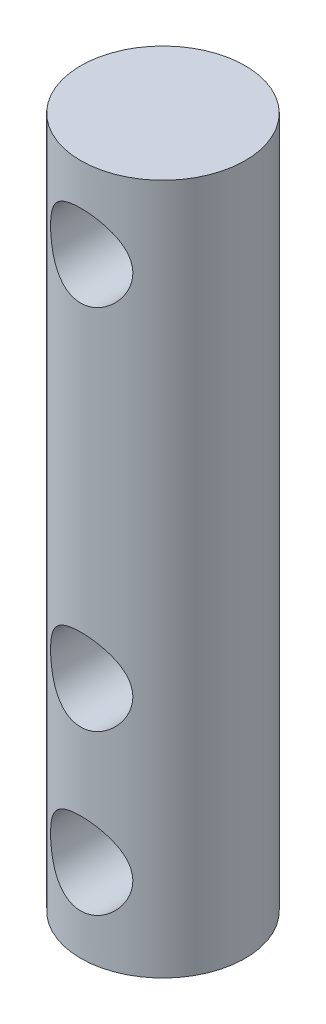
from build123d import *

# Parameters (mm, degrees)
SKETCH1_R               = 2.5
BOSS_EXTRUDE1_DEPTH     = 21
CUT_EXTRUDE1_DEPTH      = 22.295539439
CUT_EXTRUDE1_DEPTH_BACK = 22.295539439
SKETCH2_R               = 1.25


with BuildPart() as part:
    # Sketch1 → Boss-Extrude1 (new body)
    with BuildSketch(Plane(origin=(0, 0, 0), x_dir=(1, 0, 0), z_dir=(0, 1, 0))):
        Circle(SKETCH1_R)
    extrude(amount=BOSS_EXTRUDE1_DEPTH)

    # Sketch2 → Cut-Extrude1 (cut, two sides: drawn at the far end of the back side and taken through both)
    with BuildSketch(Plane.XY.offset(-CUT_EXTRUDE1_DEPTH_BACK)):
        with Locations((0, 18.5)):
            Circle(SKETCH2_R)
        with Locations((0, 2.5)):
            Circle(SKETCH2_R)
        with Locations((0, 7.34)):
            Circle(SKETCH2_R)
    extrude(amount=CUT_EXTRUDE1_DEPTH + CUT_EXTRUDE1_DEPTH_BACK, mode=Mode.SUBTRACT)


solid = part.part
